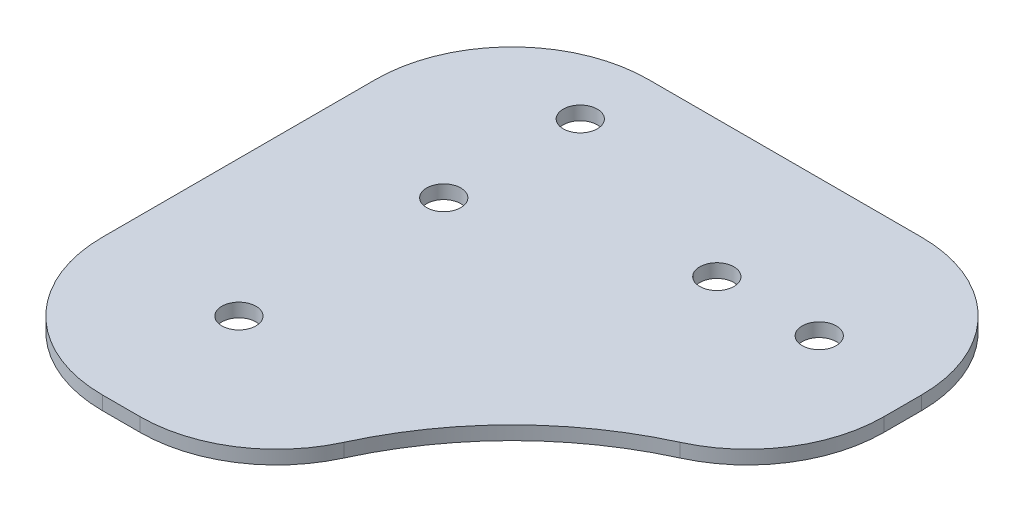
from build123d import *

# Parameters (mm, degrees)
SKETCH1_R           = 2.5
SKETCH1_W           = 40
SKETCH1_H           = 40
BOSS_EXTRUDE1_DEPTH = 2
FILLET1_R           = 50
FILLET2_R           = 20


with BuildPart() as part:
    # Sketch1 → Boss-Extrude1 (new body)
    # profile 1 of 2: a face of its own
    with BuildSketch(Plane(origin=(0, 0, 0), x_dir=(1, 0, 0), z_dir=(0, 1, 0))):
        Polygon((80, 0), (80, 40), (0, 40), (0, 0), (40, 0), align=None)
        with Locations(Location((20, 10, 0), (0, 0, 270))):
            Circle(SKETCH1_R, mode=Mode.SUBTRACT)
        with Locations(Location((20, 30, 0), (0, 0, 270))):
            Circle(SKETCH1_R, mode=Mode.SUBTRACT)
        with Locations(Location((50, 20, 0), (0, 0, 270))):
            Circle(SKETCH1_R, mode=Mode.SUBTRACT)
        with Locations(Location((65, 20, 0), (0, 0, 270))):
            Circle(SKETCH1_R, mode=Mode.SUBTRACT)
    # profile 2 of 2: a face of its own
    with BuildSketch(Plane(origin=(0, 0, 0), x_dir=(1, 0, 0), z_dir=(0, 1, 0))):
        with Locations((20, -20)):
            Rectangle(SKETCH1_W, SKETCH1_H)
        with Locations(Location((20, -20, 0), (0, 0, 270))):
            Circle(SKETCH1_R, mode=Mode.SUBTRACT)
    extrude(amount=BOSS_EXTRUDE1_DEPTH)

    # Fillet1
    # the kernel refuses this fillet: 50 mm, written as the material it adds along each edge
    with BuildSketch(Plane(origin=(40, 0, 0), x_dir=(0, 0, 1), z_dir=(0, 1, 0))) as fillet1_piece_1:
        with BuildLine():
            CenterArc((49.154759474, 49.154759474), FILLET1_R, 190.550098012, 68.899803976)
            Line((0, 40), (0, 0))
            Line((0, 0), (40, 0))
        make_face()
    extrude(amount=2)

    # Fillet2
    fillet2_edges = [part.edges().sort_by_distance(p)[0] for p in [
        (80, 1, -40),
        (80, 1, 0),
        (40, 1, 40),
        (0, 1, 40),
        (0, 1, -40),
    ]]
    fillet(fillet2_edges, radius=FILLET2_R)


solid = part.part
